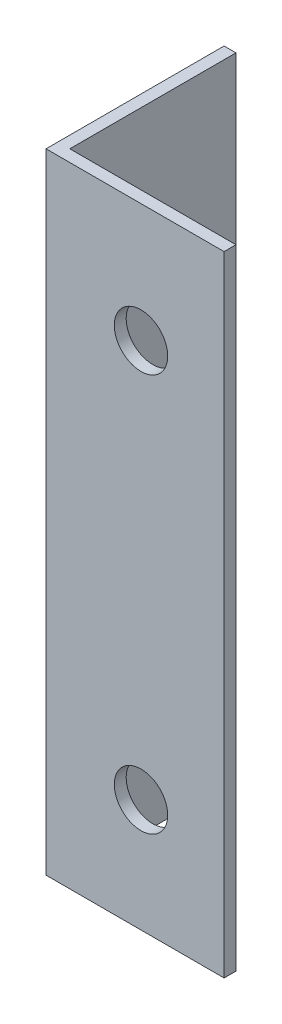
from build123d import *

# Parameters (mm, degrees)
EXTRUDE_1_DEPTH     = 53
SKETCH_2_R          = 2.25
CUT_EXTRUDE_1_DEPTH = 57.833088954


with BuildPart() as part:
    # Эскиз1 → Бобышка-Вытянуть1 (new body)
    with BuildSketch(Plane(origin=(0, 0, 0), x_dir=(1, 0, 0), z_dir=(0, 1, 0))):
        Polygon((0, 0), (0, 15), (1, 15), (1, 1), (15, 1), (15, 0), align=None)
    extrude(amount=EXTRUDE_1_DEPTH)

    # Эскиз2 → Вырез-Вытянуть1 (cut, through all)
    with BuildSketch(Plane(origin=(0, 0, -1), x_dir=(-1, 0, 0), z_dir=(0, 0, -1))):
        with Locations((-8, 43)):
            Circle(SKETCH_2_R)
        with Locations((-8, 9.5)):
            Circle(SKETCH_2_R)
    extrude(amount=-CUT_EXTRUDE_1_DEPTH, mode=Mode.SUBTRACT)


solid = part.part
